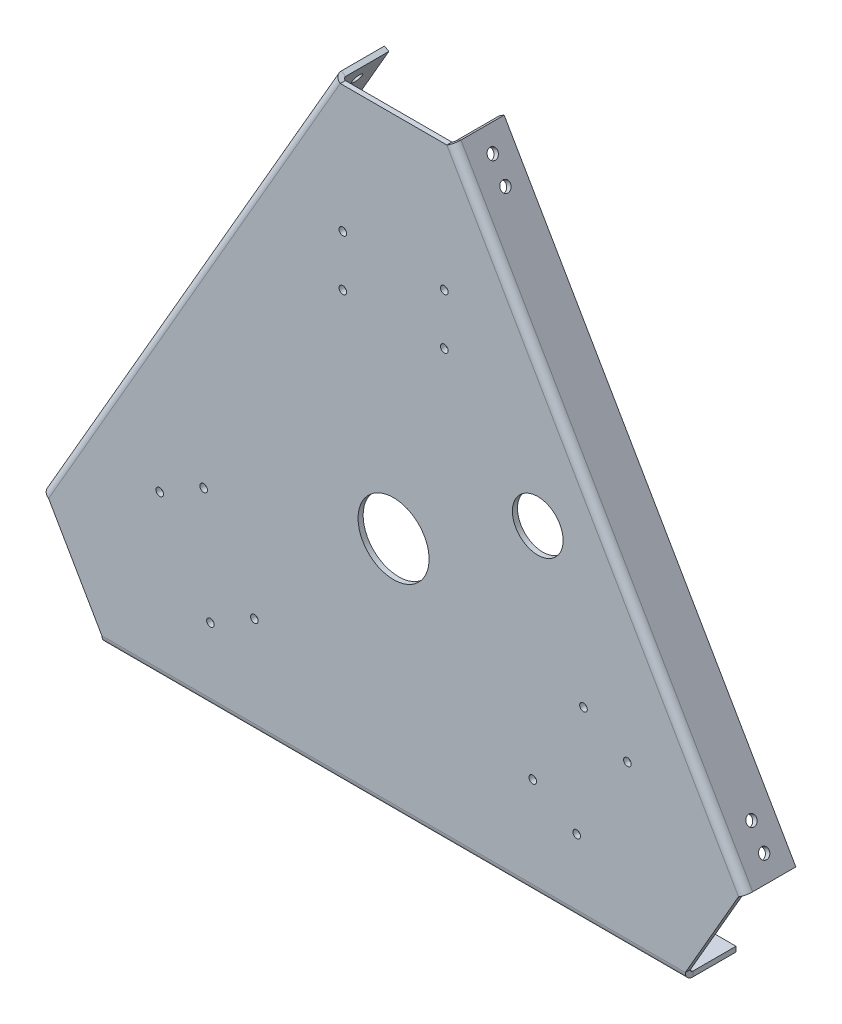
from build123d import *

# Parameters (mm, degrees)
SKETCH_10_R                   = 10
SM_BASE_FLANGE_3_DEPTH        = 2
SM_EDGE_FLANGE_6_DEPTH        = 230
SM_EDGE_FLANGE_6_BEND_DEPTH   = 230
SM_EDGE_FLANGE_6_BEND_2_DEPTH = 230
CUT_EXTRUDE_4_REACH           = 363.137
SKETCH_47_R                   = 2
CUT_EXTRUDE_6_REACH           = 263.424
SKETCH_50_R                   = 2
CUT_EXTRUDE_7_REACH           = 351.772
SKETCH_51_R                   = 2
CUT_EXTRUDE_8_REACH           = 349.61
SKETCH_52_R                   = 14
SKETCH_53_R                   = 1.5
CUT_EXTRUDE_9_DEPTH           = 10


# Sheet-metal steps are written as plain solids
with BuildPart() as part:
    # Эскиз10 → Базовая кромка3 (new body)
    with BuildSketch(Plane.XY):
        Polygon((0, 0), (-21, 36.373066959), (94, 235.558909829), (136, 235.558909829), (251, 36.373066959), (230, 0), align=None)
        with Locations((171.849364905, 123.465988394)):
            Circle(SKETCH_10_R, mode=Mode.SUBTRACT)
    extrude(amount=-SM_BASE_FLANGE_3_DEPTH)

    # Ребро-кромка6 section (across the edge) → Ребро-кромка6 (add)
    with BuildSketch(Plane(origin=(-21.866025404, 36.873066959, -2), x_dir=(0.8660254037844436, -0.4999999999999914, -3.4914813388431334e-15), z_dir=(0.4999999999999914, 0.8660254037844436, 0))):
        with BuildLine():
            Line((-2, 1), (-2, 18))
            Line((-2, 18), (0, 18))
            Line((0, 18), (0, 1))
            ThreePointArc((0, 1), (0.292893219, 0.292893219), (1, 0))
            Line((1, 0), (1, -2))
            ThreePointArc((1, -2), (-1.121320344, -1.121320344), (-2, 1))
        make_face()
    extrude(amount=SM_EDGE_FLANGE_6_DEPTH)

    # Ребро-кромка6 section 2 (across the edge) → Ребро-кромка6 bend (add)
    with BuildSketch(Plane(origin=(136.866025404, 236.058909829, -2), x_dir=(-0.8660254037844363, -0.5000000000000041, -3.4914813388431334e-15), z_dir=(0.5000000000000041, -0.8660254037844363, 0))):
        with BuildLine():
            Line((-2, 1), (-2, 18))
            Line((-2, 18), (0, 18))
            Line((0, 18), (0, 1))
            ThreePointArc((0, 1), (0.292893219, 0.292893219), (1, 0))
            Line((1, 0), (1, -2))
            ThreePointArc((1, -2), (-1.121320344, -1.121320344), (-2, 1))
        make_face()
    extrude(amount=SM_EDGE_FLANGE_6_BEND_DEPTH)

    # Ребро-кромка6 section 3 (across the edge) → Ребро-кромка6 bend 2 (add)
    with BuildSketch(Plane(origin=(230, -1, -2), x_dir=(0, 1, 0), z_dir=(-1, 0, 0))):
        with BuildLine():
            Line((-2, 1), (-2, 18))
            Line((-2, 18), (0, 18))
            Line((0, 18), (0, 1))
            ThreePointArc((0, 1), (0.292893219, 0.292893219), (1, 0))
            Line((1, 0), (1, -2))
            ThreePointArc((1, -2), (-1.121320344, -1.121320344), (-2, 1))
        make_face()
    extrude(amount=SM_EDGE_FLANGE_6_BEND_2_DEPTH)

    # Эскиз47 → Вырез-Вытянуть4 (cut, up to next)
    with BuildSketch(Plane(origin=(-34.098076211, 19.686533479, 0), x_dir=(0, 0, 1), z_dir=(-0.866025403784443, 0.4999999999999925, 3.788649256556814e-15)), mode=Mode.PRIVATE) as cut_extrude_4_sk1:
        with Locations(Location((-11.5, 29, 0), (0, 0, 270))):
            Circle(SKETCH_47_R)
    cut_extrude_4_tool1 = extrude(cut_extrude_4_sk1.sketch, amount=-CUT_EXTRUDE_4_REACH, mode=Mode.PRIVATE) & part.part
    # Эскиз47 → Вырез-Вытянуть4 (cut, up to next)
    with BuildSketch(Plane(origin=(-34.098076211, 19.686533479, 0), x_dir=(0, 0, 1), z_dir=(-0.866025403784443, 0.4999999999999925, 3.788649256556814e-15)), mode=Mode.PRIVATE) as cut_extrude_4_sk2:
        with Locations(Location((-11.5, 39, 0), (0, 0, 270))):
            Circle(SKETCH_47_R)
    cut_extrude_4_tool2 = extrude(cut_extrude_4_sk2.sketch, amount=-CUT_EXTRUDE_4_REACH, mode=Mode.PRIVATE) & part.part
    # Эскиз47 → Вырез-Вытянуть4 (cut, up to next)
    with BuildSketch(Plane(origin=(-34.098076211, 19.686533479, 0), x_dir=(0, 0, 1), z_dir=(-0.866025403784443, 0.4999999999999925, 3.788649256556814e-15)), mode=Mode.PRIVATE) as cut_extrude_4_sk3:
        with Locations(Location((-11.5, 233, 0), (0, 0, 270))):
            Circle(SKETCH_47_R)
    cut_extrude_4_tool3 = extrude(cut_extrude_4_sk3.sketch, amount=-CUT_EXTRUDE_4_REACH, mode=Mode.PRIVATE) & part.part
    # Эскиз47 → Вырез-Вытянуть4 (cut, up to next)
    with BuildSketch(Plane(origin=(-34.098076211, 19.686533479, 0), x_dir=(0, 0, 1), z_dir=(-0.866025403784443, 0.4999999999999925, 3.788649256556814e-15)), mode=Mode.PRIVATE) as cut_extrude_4_sk4:
        with Locations(Location((-11.5, 243, 0), (0, 0, 270))):
            Circle(SKETCH_47_R)
    cut_extrude_4_tool4 = extrude(cut_extrude_4_sk4.sketch, amount=-CUT_EXTRUDE_4_REACH, mode=Mode.PRIVATE) & part.part
    add(cut_extrude_4_tool1.solids().sort_by_distance((-19.598076, 44.80127, -11.5))[0], mode=Mode.SUBTRACT)
    add(cut_extrude_4_tool2.solids().sort_by_distance((-14.598076, 53.461524, -11.5))[0], mode=Mode.SUBTRACT)
    add(cut_extrude_4_tool3.solids().sort_by_distance((82.401924, 221.470453, -11.5))[0], mode=Mode.SUBTRACT)
    add(cut_extrude_4_tool4.solids().sort_by_distance((87.401924, 230.130707, -11.5))[0], mode=Mode.SUBTRACT)

    # Эскиз50 → Вырез-Вытянуть6 (cut, up to next)
    with BuildSketch(Plane(origin=(206.598076211, 119.279454915, 0), x_dir=(0, 0, -1), z_dir=(0.866025403784436, 0.5000000000000047, 3.0623287353932815e-15)), mode=Mode.PRIVATE) as cut_extrude_6_sk1:
        with Locations(Location((11.5, -86, 0), (0, 0, 90))):
            Circle(SKETCH_50_R)
    cut_extrude_6_tool1 = extrude(cut_extrude_6_sk1.sketch, amount=-CUT_EXTRUDE_6_REACH, mode=Mode.PRIVATE) & part.part
    # Эскиз50 → Вырез-Вытянуть6 (cut, up to next)
    with BuildSketch(Plane(origin=(206.598076211, 119.279454915, 0), x_dir=(0, 0, -1), z_dir=(0.866025403784436, 0.5000000000000047, 3.0623287353932815e-15)), mode=Mode.PRIVATE) as cut_extrude_6_sk2:
        with Locations(Location((11.5, -76, 0), (0, 0, 90))):
            Circle(SKETCH_50_R)
    cut_extrude_6_tool2 = extrude(cut_extrude_6_sk2.sketch, amount=-CUT_EXTRUDE_6_REACH, mode=Mode.PRIVATE) & part.part
    # Эскиз50 → Вырез-Вытянуть6 (cut, up to next)
    with BuildSketch(Plane(origin=(206.598076211, 119.279454915, 0), x_dir=(0, 0, -1), z_dir=(0.866025403784436, 0.5000000000000047, 3.0623287353932815e-15)), mode=Mode.PRIVATE) as cut_extrude_6_sk3:
        with Locations(Location((11.5, 118, 0), (0, 0, 90))):
            Circle(SKETCH_50_R)
    cut_extrude_6_tool3 = extrude(cut_extrude_6_sk3.sketch, amount=-CUT_EXTRUDE_6_REACH, mode=Mode.PRIVATE) & part.part
    # Эскиз50 → Вырез-Вытянуть6 (cut, up to next)
    with BuildSketch(Plane(origin=(206.598076211, 119.279454915, 0), x_dir=(0, 0, -1), z_dir=(0.866025403784436, 0.5000000000000047, 3.0623287353932815e-15)), mode=Mode.PRIVATE) as cut_extrude_6_sk4:
        with Locations(Location((11.5, 128, 0), (0, 0, 90))):
            Circle(SKETCH_50_R)
    cut_extrude_6_tool4 = extrude(cut_extrude_6_sk4.sketch, amount=-CUT_EXTRUDE_6_REACH, mode=Mode.PRIVATE) & part.part
    add(cut_extrude_6_tool1.solids().sort_by_distance((249.598076, 44.80127, -11.5))[0], mode=Mode.SUBTRACT)
    add(cut_extrude_6_tool2.solids().sort_by_distance((244.598076, 53.461524, -11.5))[0], mode=Mode.SUBTRACT)
    add(cut_extrude_6_tool3.solids().sort_by_distance((147.598076, 221.470453, -11.5))[0], mode=Mode.SUBTRACT)
    add(cut_extrude_6_tool4.solids().sort_by_distance((142.598076, 230.130707, -11.5))[0], mode=Mode.SUBTRACT)

    # Эскиз51 → Вырез-Вытянуть7 (cut, up to next)
    with BuildSketch(Plane.XZ.offset(3), mode=Mode.PRIVATE) as cut_extrude_7_sk1:
        with Locations(Location((222, -11.5, 0), (0, 0, 270))):
            Circle(SKETCH_51_R)
    cut_extrude_7_tool1 = extrude(cut_extrude_7_sk1.sketch, amount=-CUT_EXTRUDE_7_REACH, mode=Mode.PRIVATE) & part.part
    # Эскиз51 → Вырез-Вытянуть7 (cut, up to next)
    with BuildSketch(Plane.XZ.offset(3), mode=Mode.PRIVATE) as cut_extrude_7_sk2:
        with Locations(Location((212, -11.5, 0), (0, 0, 270))):
            Circle(SKETCH_51_R)
    cut_extrude_7_tool2 = extrude(cut_extrude_7_sk2.sketch, amount=-CUT_EXTRUDE_7_REACH, mode=Mode.PRIVATE) & part.part
    # Эскиз51 → Вырез-Вытянуть7 (cut, up to next)
    with BuildSketch(Plane.XZ.offset(3), mode=Mode.PRIVATE) as cut_extrude_7_sk3:
        with Locations(Location((18, -11.5, 0), (0, 0, 270))):
            Circle(SKETCH_51_R)
    cut_extrude_7_tool3 = extrude(cut_extrude_7_sk3.sketch, amount=-CUT_EXTRUDE_7_REACH, mode=Mode.PRIVATE) & part.part
    # Эскиз51 → Вырез-Вытянуть7 (cut, up to next)
    with BuildSketch(Plane.XZ.offset(3), mode=Mode.PRIVATE) as cut_extrude_7_sk4:
        with Locations(Location((8, -11.5, 0), (0, 0, 270))):
            Circle(SKETCH_51_R)
    cut_extrude_7_tool4 = extrude(cut_extrude_7_sk4.sketch, amount=-CUT_EXTRUDE_7_REACH, mode=Mode.PRIVATE) & part.part
    add(cut_extrude_7_tool1.solids().sort_by_distance((222, -3, -11.5))[0], mode=Mode.SUBTRACT)
    add(cut_extrude_7_tool2.solids().sort_by_distance((212, -3, -11.5))[0], mode=Mode.SUBTRACT)
    add(cut_extrude_7_tool3.solids().sort_by_distance((18, -3, -11.5))[0], mode=Mode.SUBTRACT)
    add(cut_extrude_7_tool4.solids().sort_by_distance((8, -3, -11.5))[0], mode=Mode.SUBTRACT)

    # Эскиз52 → Вырез-Вытянуть8 (cut, up to next)
    with BuildSketch(Plane(origin=(0, 0, -2), x_dir=(-1, 0, 0), z_dir=(0, 0, -1)), mode=Mode.PRIVATE) as cut_extrude_8_sk1:
        with Locations((-115, 90.643992263)):
            Circle(SKETCH_52_R)
    cut_extrude_8_tool1 = extrude(cut_extrude_8_sk1.sketch, amount=-CUT_EXTRUDE_8_REACH, mode=Mode.PRIVATE) & part.part
    add(cut_extrude_8_tool1.solids().sort_by_distance((115, 90.643992, -2))[0], mode=Mode.SUBTRACT)

    # Эскиз53 → Вырез-Вытянуть9 (cut)
    with BuildSketch(Plane(origin=(0, 0, -2), x_dir=(-1, 0, 0), z_dir=(0, 0, -1))):
        with Locations((-40.121778265, 70.507041555)):
            Circle(SKETCH_53_R)
        with Locations((-22.801270189, 60.507041555)):
            Circle(SKETCH_53_R)
        with Locations((-60.121778265, 35.866025404)):
            Circle(SKETCH_53_R)
        with Locations((-42.801270189, 25.866025404)):
            Circle(SKETCH_53_R)
        with Locations((-95, 185.558909829)):
            Circle(SKETCH_53_R)
        with Locations((-95, 165.558909829)):
            Circle(SKETCH_53_R)
        with Locations((-135, 185.558909829)):
            Circle(SKETCH_53_R)
        with Locations((-135, 165.558909829)):
            Circle(SKETCH_53_R)
        with Locations((-207.198729811, 60.507041555)):
            Circle(SKETCH_53_R)
        with Locations((-189.878221735, 70.507041555)):
            Circle(SKETCH_53_R)
        with Locations((-187.198729811, 25.866025404)):
            Circle(SKETCH_53_R)
        with Locations((-169.878221735, 35.866025404)):
            Circle(SKETCH_53_R)
    extrude(amount=-CUT_EXTRUDE_9_DEPTH, mode=Mode.SUBTRACT)


solid = part.part
